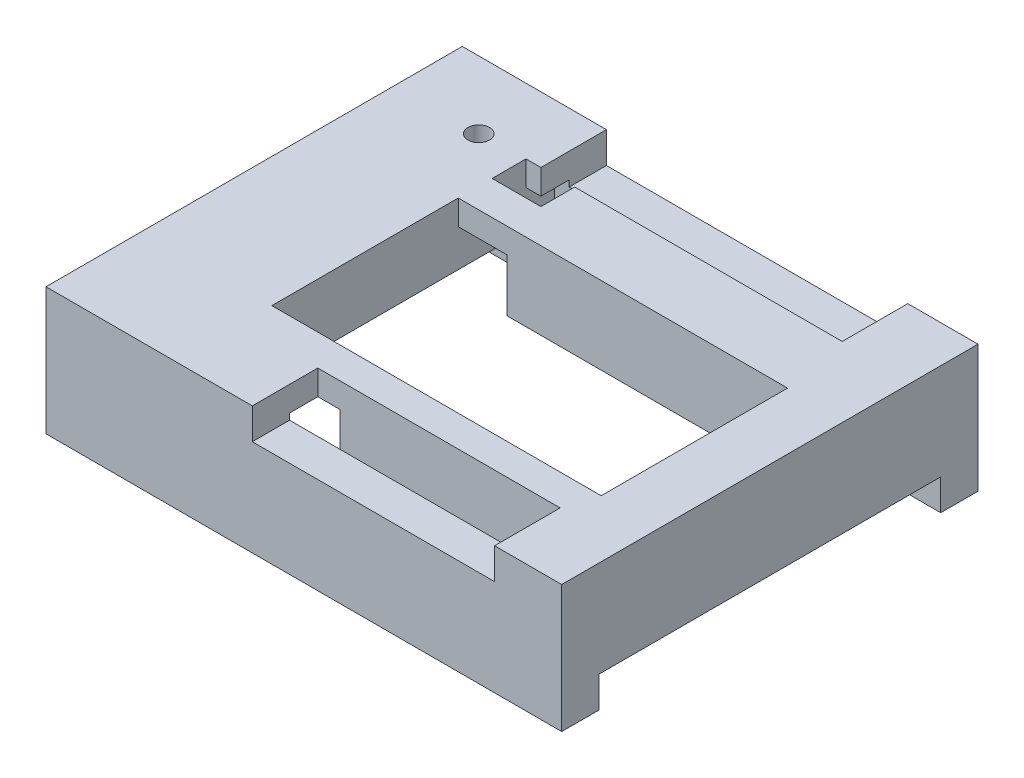
from build123d import *

# Parameters (mm, degrees)
SKETCH1_R               = 1.75
SKETCH1_W               = 53
SKETCH1_H               = 30
BOSS_EXTRUDE1_DEPTH     = 2
BOSS_EXTRUDE2_OUTLINE_R = 1.75
BOSS_EXTRUDE2_DEPTH     = 11.5
SKETCH3_R               = 1.75
SKETCH3_W               = 53
SKETCH3_H               = 30
BOSS_EXTRUDE3_DEPTH     = 2
BOSS_EXTRUDE4_DEPTH     = 6
BOSS_EXTRUDE5_DEPTH     = 6
SKETCH7_W               = 3.3
SKETCH7_H               = 5
CUT_EXTRUDE3_DEPTH      = 2
SKETCH9_W               = 55
SKETCH9_H               = 5.5
CUT_EXTRUDE5_DEPTH      = 14
SKETCH10_W              = 5.5
SKETCH10_H              = 11.5
BOSS_EXTRUDE6_DEPTH     = 55
BOSS_EXTRUDE8_DEPTH     = 8.5
CUT_EXTRUDE6_DEPTH      = 3
SKETCH15_R              = 1.3
CUT_EXTRUDE7_DEPTH      = 8


# Read off the part's stored shape, not the designer's step: Boss-Extrude2
with BuildPart() as part:
    # Sketch1 → Boss-Extrude1 (new body)
    with BuildSketch(Plane(origin=(0, 0, 0), x_dir=(1, 0, 0), z_dir=(0, 1, 0))):
        Polygon((0, 0), (23.2, 0), (23.2, -4.55), (20.8, -4.55), (20.8, -10), (28.65, -10), (28.65, -4.55), (71.7, -4.55), (71.7, 0), (83, 0), (83, -22.35), (83, -30.15), (83, -55), (72.2, -55), (72.2, -50.45), (33.2, -50.45), (33.2, -55), (0, -55), (0, -50.35), (19, -50.35), (19, -41.35), (0, -41.35), (0, -21.95), (17, -21.95), (17, -9.75), (0, -9.75), align=None)
        with Locations(Location((13.5, -4.85, 0), (0, 0, 270))):
            Circle(SKETCH1_R, mode=Mode.SUBTRACT)
        with Locations((47.3, -30.45)):
            Rectangle(SKETCH1_W, SKETCH1_H, mode=Mode.SUBTRACT)
    extrude(amount=BOSS_EXTRUDE1_DEPTH)

    # Boss-Extrude2 outline → Boss-Extrude2 (add)
    with BuildSketch(Plane.XZ):
        Polygon((0, 9.75), (0, 0), (20.8, 0), (20.8, 55), (0, 55), (0, 50.35), (19, 50.35), (19, 41.35), (0, 41.35), (0, 21.95), (17, 21.95), (17, 9.75), align=None)
        with Locations((13.5, 4.85)):
            Circle(BOSS_EXTRUDE2_OUTLINE_R, mode=Mode.SUBTRACT)
    extrude(amount=BOSS_EXTRUDE2_DEPTH)

    # Sketch3 → Boss-Extrude3 (add)
    with BuildSketch(Plane(origin=(0, 2, 0), x_dir=(1, 0, 0), z_dir=(0, 1, 0))):
        Polygon((23.2, 0), (0, 0), (0, -55), (33.2, -55), (33.2, -50.45), (72.2, -50.45), (72.2, -55), (83, -55), (83, 0), (71.7, 0), (71.7, -4.55), (28.65, -4.55), (28.65, -10), (20.8, -10), (20.8, -4.55), (23.2, -4.55), align=None)
        with Locations(Location((13.5, -4.85, 0), (0, 0, 90))):
            Circle(SKETCH3_R, mode=Mode.SUBTRACT)
        with Locations((47.3, -30.45)):
            Rectangle(SKETCH3_W, SKETCH3_H, mode=Mode.SUBTRACT)
    extrude(amount=BOSS_EXTRUDE3_DEPTH)

    # Sketch4 → Boss-Extrude4 (add)
    with BuildSketch(Plane.XY.offset(55)):
        Polygon((0, 4), (33.2, 4), (33.2, 0), (33.2, -1), (72.2, -1), (72.2, 0), (72.2, 4), (83, 4), (83, -11.5), (83, -16.5), (0, -16.5), (0, -11.5), align=None)
    extrude(amount=BOSS_EXTRUDE4_DEPTH)

    # Sketch5 → Boss-Extrude5 (add)
    with BuildSketch(Plane(origin=(0, 0, 0), x_dir=(-1, 0, 0), z_dir=(0, 0, -1))):
        Polygon((-23.2, 4), (-23.2, 0), (-23.2, -1), (-71.7, -1), (-71.7, 0), (-71.7, 4), (-83, 4), (-83, -11.5), (-83, -16.5), (0, -16.5), (0, -11.5), (0, 4), align=None)
    extrude(amount=BOSS_EXTRUDE5_DEPTH)

    # Sketch7 → Cut-Extrude3 (cut)
    with BuildSketch(Plane(origin=(0, 0, 55), x_dir=(-1, 0, 0), z_dir=(0, 0, -1))):
        with Locations((-14.15, -14)):
            Rectangle(SKETCH7_W, SKETCH7_H)
        with Locations((-68.85, -14)):
            Rectangle(SKETCH7_W, SKETCH7_H)
    extrude(amount=-CUT_EXTRUDE3_DEPTH, mode=Mode.SUBTRACT)

    # Sketch9 → Cut-Extrude5 (cut)
    with BuildSketch(Plane(origin=(20.8, 0, 0), x_dir=(0, 0, -1), z_dir=(1, 0, 0))):
        with Locations((-27.5, -8.75)):
            Rectangle(SKETCH9_W, SKETCH9_H)
    extrude(amount=-CUT_EXTRUDE5_DEPTH, mode=Mode.SUBTRACT)

    # Sketch10 → Boss-Extrude6 (add)
    with BuildSketch(Plane(origin=(0, 0, 55), x_dir=(-1, 0, 0), z_dir=(0, 0, -1))):
        with Locations((-80.25, -5.75)):
            Rectangle(SKETCH10_W, SKETCH10_H)
    extrude(amount=BOSS_EXTRUDE6_DEPTH)

    # Sketch12 → Boss-Extrude8 (add)
    with BuildSketch(Plane.XZ):
        Polygon((73.8, 45.45), (77.5, 45.45), (77.5, 50.45), (72.2, 50.45), (36.8, 50.45), (36.8, 45.45), align=None)
        Polygon((28.65, 10), (28.65, 4.55), (71.7, 4.55), (77.5, 4.55), (77.5, 15.45), (73.8, 15.45), (28.65, 15.45), align=None)
    extrude(amount=BOSS_EXTRUDE8_DEPTH)

    # Sketch14 → Cut-Extrude6 (cut)
    with BuildSketch(Plane.XZ.offset(16.5)):
        Polygon((79.299038106, 55.75), (80.598076211, 58), (79.299038106, 60.25), (76.700961894, 60.25), (75.401923789, 58), (76.700961894, 55.75), align=None)
        Polygon((6.299038106, 55.75), (3.700961894, 55.75), (2.401923789, 58), (3.700961894, 60.25), (6.299038106, 60.25), (7.598076211, 58), align=None)
        Polygon((3.700961894, -0.75), (2.401923789, -3), (3.700961894, -5.25), (6.299038106, -5.25), (7.598076211, -3), (6.299038106, -0.75), align=None)
        Polygon((76.700961894, -0.75), (79.299038106, -0.75), (80.598076211, -3), (79.299038106, -5.25), (76.700961894, -5.25), (75.401923789, -3), align=None)
    extrude(amount=-CUT_EXTRUDE6_DEPTH, mode=Mode.SUBTRACT)

    # Sketch15 → Cut-Extrude7 (cut)
    with BuildSketch(Plane.XZ.offset(16.5)):
        with Locations(Location((78, 58, 0), (0, 0, 270))):
            Circle(SKETCH15_R)
        with Locations(Location((5, 58, 0), (0, 0, 90))):
            Circle(SKETCH15_R)
        with Locations(Location((78, -3, 0), (0, 0, 90))):
            Circle(SKETCH15_R)
        with Locations(Location((5, -3, 0), (0, 0, 270))):
            Circle(SKETCH15_R)
    extrude(amount=-CUT_EXTRUDE7_DEPTH, mode=Mode.SUBTRACT)


solid = part.part
